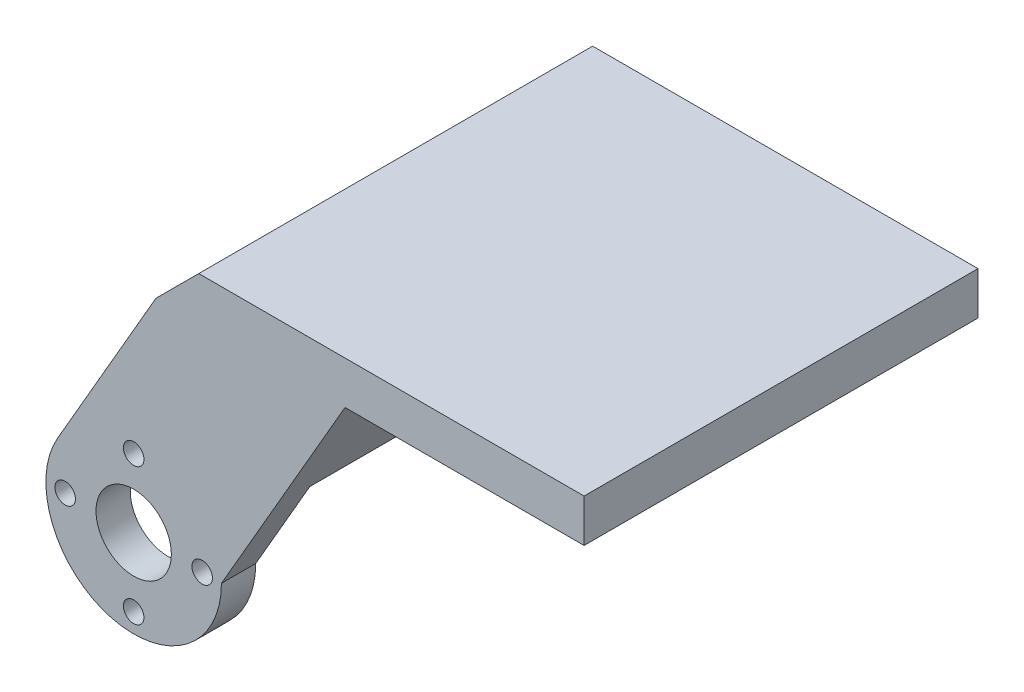
from build123d import *

# Parameters (mm, degrees)
SKETCH1_R           = 4.4
SKETCH1_R_2         = 1.2
BOSS_EXTRUDE1_DEPTH = 46
SKETCH3_W           = 38
SKETCH3_H           = 28
CUT_EXTRUDE2_DEPTH  = 81.708866675
CHAMFER1_SIZE       = 5


with BuildPart() as part:
    # Sketch1 → Boss-Extrude1 (new body)
    with BuildSketch(Plane.XY):
        with BuildLine():
            Line((2.598076211, 25), (-8.876760389, 5.125))
            ThreePointArc((-8.876760389, 5.125), (-2.652895212, -9.900739719), (10.25, 0))
            Line((10.25, 0), (24.68375673, 25))
            Line((24.68375673, 25), (52.598076211, 25))
            Line((52.598076211, 25), (52.598076211, 30))
            Line((52.598076211, 30), (2.598076211, 30))
            Line((2.598076211, 30), (2.598076211, 25))
        make_face()
        Circle(SKETCH1_R, mode=Mode.SUBTRACT)
        with Locations((-8, 0)):
            Circle(SKETCH1_R_2, mode=Mode.SUBTRACT)
        with Locations((0, -8)):
            Circle(SKETCH1_R_2, mode=Mode.SUBTRACT)
        with Locations((8, 0)):
            Circle(SKETCH1_R_2, mode=Mode.SUBTRACT)
        with Locations((0, 8)):
            Circle(SKETCH1_R_2, mode=Mode.SUBTRACT)
    extrude(amount=-BOSS_EXTRUDE1_DEPTH)

    # Sketch3 → Cut-Extrude2 (cut, through all)
    with BuildSketch(Plane(origin=(-8.876760389, 5.125, 0), x_dir=(0, 0, 1), z_dir=(-0.8660254037844363, 0.500000000000004, 0))):
        with Locations((-23, 3.75)):
            Rectangle(SKETCH3_W, SKETCH3_H)
    extrude(amount=-CUT_EXTRUDE2_DEPTH, mode=Mode.SUBTRACT)

    # Chamfer1
    chamfer1_edges = [part.edges().sort_by_distance(p)[0] for p in [
        (2.598076211, 30, -23),
    ]]
    chamfer(chamfer1_edges, length=CHAMFER1_SIZE - 0.0001)  # a hair under: the kernel refuses the full size


solid = part.part
